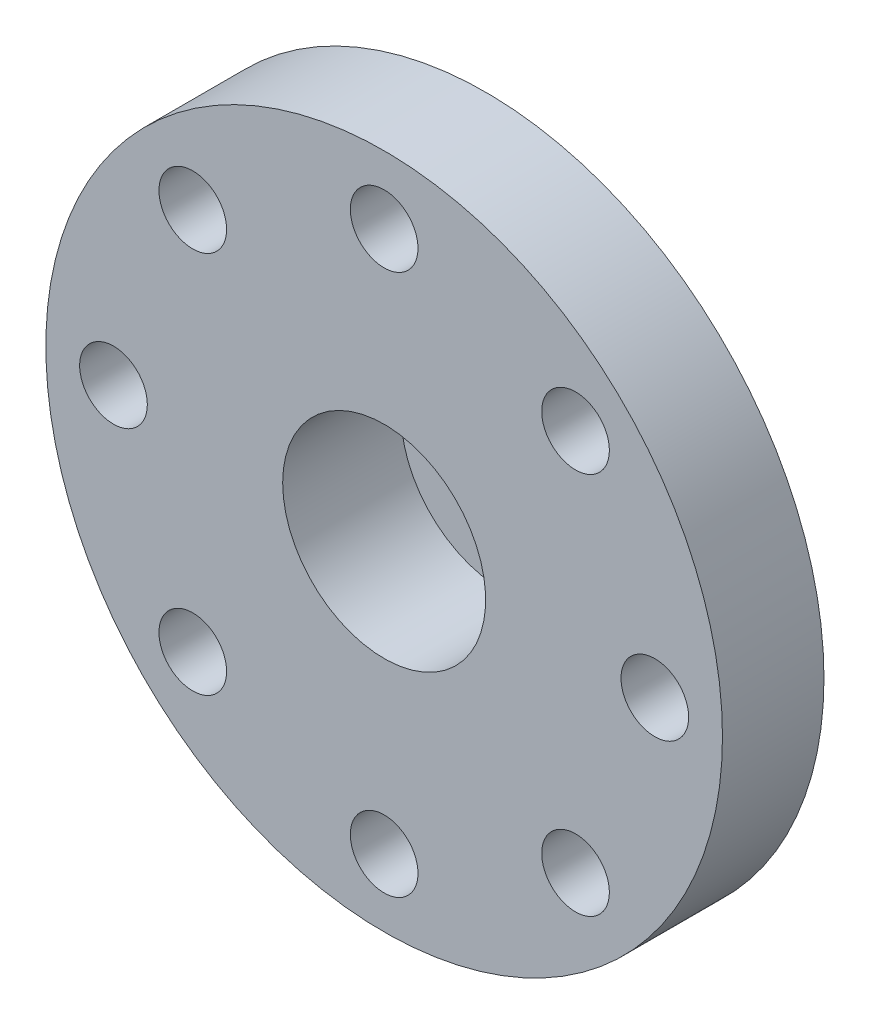
from build123d import *

# Parameters (mm, degrees)
SKETCH_1_R          = 10
SKETCH_1_R_2        = 1.5
SKETCH_1_R_3        = 1
EXTRUDE_1_DEPTH     = 3
SKETCH_2_R          = 4.5
EXTRUDE_2_DEPTH     = 2
SKETCH_3_R          = 3
CUT_EXTRUDE_1_DEPTH = 3.5
SKETCH_4_R          = 1.5
CUT_EXTRUDE_2_DEPTH = 10


with BuildPart() as part:
    # 草图1 → 凸台-拉伸1 (new body)
    with BuildSketch(Plane.XY):
        Circle(SKETCH_1_R)
        Circle(SKETCH_1_R_2, mode=Mode.SUBTRACT)
        with Locations((0, 8)):
            Circle(SKETCH_1_R_3, mode=Mode.SUBTRACT)
        with Locations((5.656854249, 5.656854249)):
            Circle(SKETCH_1_R_3, mode=Mode.SUBTRACT)
        with Locations((8, 0)):
            Circle(SKETCH_1_R_3, mode=Mode.SUBTRACT)
        with Locations((5.656854249, -5.656854249)):
            Circle(SKETCH_1_R_3, mode=Mode.SUBTRACT)
        with Locations((0, -8)):
            Circle(SKETCH_1_R_3, mode=Mode.SUBTRACT)
        with Locations((-5.656854249, -5.656854249)):
            Circle(SKETCH_1_R_3, mode=Mode.SUBTRACT)
        with Locations((-8, 0)):
            Circle(SKETCH_1_R_3, mode=Mode.SUBTRACT)
        with Locations((-5.656854249, 5.656854249)):
            Circle(SKETCH_1_R_3, mode=Mode.SUBTRACT)
    extrude(amount=EXTRUDE_1_DEPTH)

    # 草图2 → 凸台-拉伸2 (add)
    with BuildSketch(Plane(origin=(0, 0, 0), x_dir=(-1, 0, 0), z_dir=(0, 0, -1))):
        Circle(SKETCH_2_R)
    extrude(amount=EXTRUDE_2_DEPTH)

    # 草图3 → 切除-拉伸1 (cut)
    with BuildSketch(Plane(origin=(0, 0, 3), x_dir=(-1, 0, 0), z_dir=(0, 0, -1))):
        Circle(SKETCH_3_R)
    extrude(amount=CUT_EXTRUDE_1_DEPTH, mode=Mode.SUBTRACT)

    # 草图4 → 切除-拉伸2 (cut)
    with BuildSketch(Plane(origin=(0, 0, -2), x_dir=(-1, 0, 0), z_dir=(0, 0, -1))):
        Circle(SKETCH_4_R)
    extrude(amount=-CUT_EXTRUDE_2_DEPTH, mode=Mode.SUBTRACT)


solid = part.part
